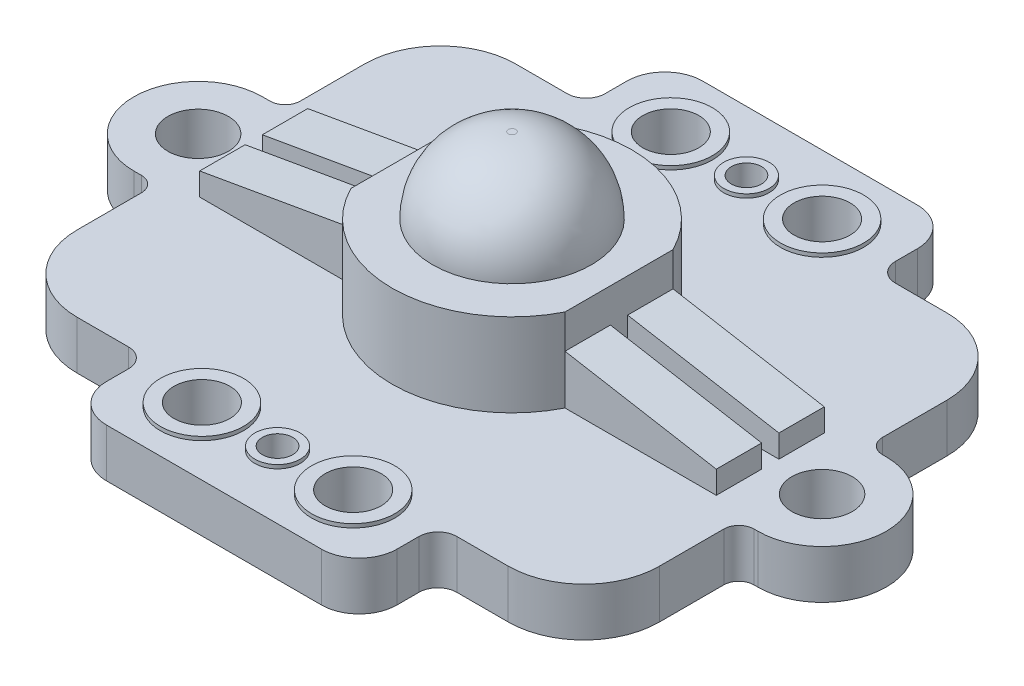
from build123d import *

# Parameters (mm, degrees)
SKETCH1_R           = 1.016
SKETCH1_R_2         = 0.508
SKETCH1_R_3         = 0.9398
BOSS_EXTRUDE1_DEPTH = 0.8128
BOSS_EXTRUDE2_DEPTH = 2.794
SKETCH3_R           = 2.667
BOSS_EXTRUDE3_DEPTH = 2.54
FILLET1_R           = 2.54
BOSS_EXTRUDE4_START = -1.651
SKETCH4_R           = 1.397
SKETCH4_R_2         = 0.9398
SKETCH4_R_3         = 0.762
SKETCH4_R_4         = 0.508
BOSS_EXTRUDE4_DEPTH = 1.778
SKETCH5_W           = 5.08
SKETCH5_H           = 1.524
BOSS_EXTRUDE5_DEPTH = 1.651
CUT_EXTRUDE1_REACH  = 20.407
SKETCH7_W           = 2.8702
SKETCH7_H           = 1.143
BOSS_EXTRUDE6_DEPTH = 0.9398
SKETCH8_W           = 2.921
SKETCH8_H           = 2.794
BOSS_EXTRUDE7_DEPTH = 1.143
SKETCH9_W           = 1.397
SKETCH9_H           = 1.905
SKETCH9_W_2         = 1.905
SKETCH9_H_2         = 1.397
BOSS_EXTRUDE8_DEPTH = 1.651


with BuildPart() as part:
    # Sketch1 → Boss-Extrude1 (new, symmetric)
    with BuildSketch(Plane(origin=(0, 0, 0), x_dir=(1, 0, 0), z_dir=(0, 1, 0))):
        with BuildLine():
            Line((-10.541, 2.159), (-10.287, 2.159))
            ThreePointArc((-10.287, 2.159), (-9.927789755, 2.307789755), (-9.779, 2.667))
            Line((-9.779, 2.667), (-9.779, 4.826))
            ThreePointArc((-9.779, 4.826), (-9.035051224, 6.622051224), (-7.239, 7.366))
            Line((-7.239, 7.366), (-5.5118, 7.366))
            ThreePointArc((-5.5118, 7.366), (-5.062787194, 7.551987194), (-4.8768, 8.001))
            Line((-4.8768, 8.001), (-4.8768, 8.7376))
            ThreePointArc((-4.8768, 8.7376), (-4.504825612, 9.635625612), (-3.6068, 10.0076))
            Line((-3.6068, 10.0076), (3.6068, 10.0076))
            ThreePointArc((3.6068, 10.0076), (4.504825612, 9.635625612), (4.8768, 8.7376))
            Line((4.8768, 8.7376), (4.8768, 8.001))
            ThreePointArc((4.8768, 8.001), (5.062787194, 7.551987194), (5.5118, 7.366))
            Line((5.5118, 7.366), (7.239, 7.366))
            ThreePointArc((7.239, 7.366), (9.035051224, 6.622051224), (9.779, 4.826))
            Line((9.779, 4.826), (9.779, 2.667))
            ThreePointArc((9.779, 2.667), (9.927789755, 2.307789755), (10.287, 2.159))
            Line((10.287, 2.159), (10.414, 2.159))
            ThreePointArc((10.414, 2.159), (12.573, 0), (10.414, -2.159))
            Line((10.414, -2.159), (10.287, -2.159))
            ThreePointArc((10.287, -2.159), (9.927789755, -2.307789755), (9.779, -2.667))
            Line((9.779, -2.667), (9.779, -4.826))
            ThreePointArc((9.779, -4.826), (9.035051224, -6.622051224), (7.239, -7.366))
            Line((7.239, -7.366), (5.5118, -7.366))
            ThreePointArc((5.5118, -7.366), (5.062787194, -7.551987194), (4.8768, -8.001))
            Line((4.8768, -8.001), (4.8768, -8.7376))
            ThreePointArc((4.8768, -8.7376), (4.504825612, -9.635625612), (3.6068, -10.0076))
            Line((3.6068, -10.0076), (-3.6068, -10.0076))
            ThreePointArc((-3.6068, -10.0076), (-4.504825612, -9.635625612), (-4.8768, -8.7376))
            Line((-4.8768, -8.7376), (-4.8768, -8.001))
            ThreePointArc((-4.8768, -8.001), (-5.062787194, -7.551987194), (-5.5118, -7.366))
            Line((-5.5118, -7.366), (-7.239, -7.366))
            ThreePointArc((-7.239, -7.366), (-9.035051224, -6.622051224), (-9.779, -4.826))
            Line((-9.779, -4.826), (-9.779, -2.667))
            ThreePointArc((-9.779, -2.667), (-9.927789755, -2.307789755), (-10.287, -2.159))
            Line((-10.287, -2.159), (-10.541, -2.159))
            ThreePointArc((-10.541, -2.159), (-12.7, 0), (-10.541, 2.159))
        make_face()
        with Locations(Location((-10.541, 0, 0), (0, 0, 270))):
            Circle(SKETCH1_R, mode=Mode.SUBTRACT)
        with Locations(Location((10.414, 0, 0), (0, 0, 270))):
            Circle(SKETCH1_R, mode=Mode.SUBTRACT)
        with Locations(Location((0, 7.874, 0), (0, 0, 270))):
            Circle(SKETCH1_R_2, mode=Mode.SUBTRACT)
        with Locations(Location((0, -7.874, 0), (0, 0, 270))):
            Circle(SKETCH1_R_2, mode=Mode.SUBTRACT)
        with Locations(Location((-2.54, 7.874, 0), (0, 0, 270))):
            Circle(SKETCH1_R_3, mode=Mode.SUBTRACT)
        with Locations(Location((2.54, 7.874, 0), (0, 0, 270))):
            Circle(SKETCH1_R_3, mode=Mode.SUBTRACT)
        with Locations(Location((-2.54, -7.874, 0), (0, 0, 270))):
            Circle(SKETCH1_R_3, mode=Mode.SUBTRACT)
        with Locations(Location((2.54, -7.874, 0), (0, 0, 270))):
            Circle(SKETCH1_R_3, mode=Mode.SUBTRACT)
    extrude(amount=BOSS_EXTRUDE1_DEPTH, both=True)

    # Sketch2 → Boss-Extrude2 (add)
    with BuildSketch(Plane(origin=(0, 0.8128, 0), x_dir=(1, 0, 0), z_dir=(0, 1, 0))):
        with BuildLine():
            Line((-3.5941, 1.813922821), (-3.5941, -1.813922821))
            ThreePointArc((-3.5941, -1.813922821), (0, -4.0259), (3.5941, -1.813922821))
            Line((3.5941, -1.813922821), (3.5941, 1.813922821))
            ThreePointArc((3.5941, 1.813922821), (0, 4.0259), (-3.5941, 1.813922821))
        make_face()
    extrude(amount=BOSS_EXTRUDE2_DEPTH)

    # Sketch3 → Boss-Extrude3 (add)
    with BuildSketch(Plane(origin=(0, 3.6068, 0), x_dir=(1, 0, 0), z_dir=(0, 1, 0))):
        with Locations(Location((0, 0, 0), (0, 0, 270))):
            Circle(SKETCH3_R)
    extrude(amount=BOSS_EXTRUDE3_DEPTH)

    # Fillet1
    fillet1_edges = [part.edges().sort_by_distance(p)[0] for p in [
        (0, 6.1468, -2.667),
    ]]
    fillet(fillet1_edges, radius=FILLET1_R - 0.0001)  # a hair under: the kernel refuses the full size

    # Sketch4 → Boss-Extrude4 (add)
    # profile 1 of 6: a face of its own
    with BuildSketch(Plane(origin=(0, 0.8128, 0), x_dir=(1, 0, 0), z_dir=(0, 1, 0)).offset(BOSS_EXTRUDE4_START)):
        with Locations(Location((2.54, -7.874, 0), (0, 0, 270))):
            Circle(SKETCH4_R)
        with Locations(Location((2.54, -7.874, 0), (0, 0, 270))):
            Circle(SKETCH4_R_2, mode=Mode.SUBTRACT)
    # profile 2 of 6: a face of its own
    with BuildSketch(Plane(origin=(0, 0.8128, 0), x_dir=(1, 0, 0), z_dir=(0, 1, 0)).offset(BOSS_EXTRUDE4_START)):
        with Locations(Location((0, -7.874, 0), (0, 0, 270))):
            Circle(SKETCH4_R_3)
        with Locations(Location((0, -7.874, 0), (0, 0, 270))):
            Circle(SKETCH4_R_4, mode=Mode.SUBTRACT)
    # profile 3 of 6: a face of its own
    with BuildSketch(Plane(origin=(0, 0.8128, 0), x_dir=(1, 0, 0), z_dir=(0, 1, 0)).offset(BOSS_EXTRUDE4_START)):
        with Locations(Location((-2.54, -7.874, 0), (0, 0, 270))):
            Circle(SKETCH4_R)
        with Locations(Location((-2.54, -7.874, 0), (0, 0, 270))):
            Circle(SKETCH4_R_2, mode=Mode.SUBTRACT)
    # profile 4 of 6: a face of its own
    with BuildSketch(Plane(origin=(0, 0.8128, 0), x_dir=(1, 0, 0), z_dir=(0, 1, 0)).offset(BOSS_EXTRUDE4_START)):
        with Locations(Location((-2.54, 7.874, 0), (0, 0, 270))):
            Circle(SKETCH4_R)
        with Locations(Location((-2.54, 7.874, 0), (0, 0, 270))):
            Circle(SKETCH4_R_2, mode=Mode.SUBTRACT)
    # profile 5 of 6: a face of its own
    with BuildSketch(Plane(origin=(0, 0.8128, 0), x_dir=(1, 0, 0), z_dir=(0, 1, 0)).offset(BOSS_EXTRUDE4_START)):
        with Locations(Location((0, 7.874, 0), (0, 0, 270))):
            Circle(SKETCH4_R_3)
        with Locations(Location((0, 7.874, 0), (0, 0, 270))):
            Circle(SKETCH4_R_4, mode=Mode.SUBTRACT)
    # profile 6 of 6: a face of its own
    with BuildSketch(Plane(origin=(0, 0.8128, 0), x_dir=(1, 0, 0), z_dir=(0, 1, 0)).offset(BOSS_EXTRUDE4_START)):
        with Locations(Location((2.54, 7.874, 0), (0, 0, 270))):
            Circle(SKETCH4_R)
        with Locations(Location((2.54, 7.874, 0), (0, 0, 270))):
            Circle(SKETCH4_R_2, mode=Mode.SUBTRACT)
    extrude(amount=BOSS_EXTRUDE4_DEPTH)

    # Sketch5 → Boss-Extrude5 (add)
    with BuildSketch(Plane(origin=(0, 0.8128, 0), x_dir=(1, 0, 0), z_dir=(0, 1, 0))):
        with Locations((6.1341, -1.051922821)):
            Rectangle(SKETCH5_W, SKETCH5_H)
        with Locations((6.1341, 1.051922821)):
            Rectangle(SKETCH5_W, SKETCH5_H)
        with Locations((-6.1341, 1.051922821)):
            Rectangle(SKETCH5_W, SKETCH5_H)
        with Locations((-6.1341, -1.051922821)):
            Rectangle(SKETCH5_W, SKETCH5_H)
    extrude(amount=BOSS_EXTRUDE5_DEPTH)

    # Cut-Extrude1: up to this face of the body (flat: up to its plane)
    cut_extrude1_end = Plane(part.part.faces().sort_by_distance((-6.1341, 1.6383, -1.813922821))[0])
    # Sketch6 → Cut-Extrude1 (cut, up to the picked face)
    with BuildSketch(Plane.XY.offset(1.813922821), mode=Mode.PRIVATE) as cut_extrude1_sk1:
        Polygon((-8.6741, 1.5748), (-3.5941, 2.4638), (-8.6741, 2.4638), align=None)
    cut_extrude1_tool1 = split(extrude(cut_extrude1_sk1.sketch, amount=-CUT_EXTRUDE1_REACH, mode=Mode.PRIVATE), bisect_by=cut_extrude1_end, keep=Keep.BOTH, mode=Mode.PRIVATE)
    # Sketch6 → Cut-Extrude1 (cut, up to the picked face)
    with BuildSketch(Plane.XY.offset(1.813922821), mode=Mode.PRIVATE) as cut_extrude1_sk2:
        Polygon((8.6741, 2.4638), (8.6741, 1.5748), (3.5941, 2.4638), align=None)
    cut_extrude1_tool2 = split(extrude(cut_extrude1_sk2.sketch, amount=-CUT_EXTRUDE1_REACH, mode=Mode.PRIVATE), bisect_by=cut_extrude1_end, keep=Keep.BOTH, mode=Mode.PRIVATE)
    add(cut_extrude1_tool1.solids().sort_by(Axis((-6.980767, 2.167467, 1.813923), (0, 0, -1)))[0], mode=Mode.SUBTRACT)
    add(cut_extrude1_tool2.solids().sort_by(Axis((6.980767, 2.167467, 1.813923), (0, 0, -1)))[0], mode=Mode.SUBTRACT)

    # Sketch7 → Boss-Extrude6 (add)
    with BuildSketch(Plane.XZ.offset(0.8128)):
        with Locations((7.2009, 4.1275)):
            Rectangle(SKETCH7_W, SKETCH7_H)
        with Locations((7.2009, -1.5875)):
            Rectangle(SKETCH7_W, SKETCH7_H)
        with Locations((3.2131, 2.2225)):
            Rectangle(SKETCH7_W, SKETCH7_H)
        with Locations((3.2131, -3.4925)):
            Rectangle(SKETCH7_W, SKETCH7_H)
        with Locations((-6.3119, -4.0005)):
            Rectangle(SKETCH7_W, SKETCH7_H)
        with Locations((-2.1971, -2.0955)):
            Rectangle(SKETCH7_W, SKETCH7_H)
    extrude(amount=BOSS_EXTRUDE6_DEPTH)

    # Sketch8 → Boss-Extrude7 (add)
    with BuildSketch(Plane(origin=(0, -0.8128, 0), x_dir=(-1, 0, 0), z_dir=(0, -1, 0))):
        with Locations((4.0005, -2.667)):
            Rectangle(SKETCH8_W, SKETCH8_H)
    extrude(amount=BOSS_EXTRUDE7_DEPTH)

    # Sketch9 → Boss-Extrude8 (add)
    with BuildSketch(Plane.XZ.offset(0.8128)):
        with Locations((-1.4605, 1.4605)):
            Rectangle(SKETCH9_W, SKETCH9_H)
        with Locations((-0.6477, 5.5245)):
            Rectangle(SKETCH9_W_2, SKETCH9_H_2)
    extrude(amount=BOSS_EXTRUDE8_DEPTH)


solid = part.part
